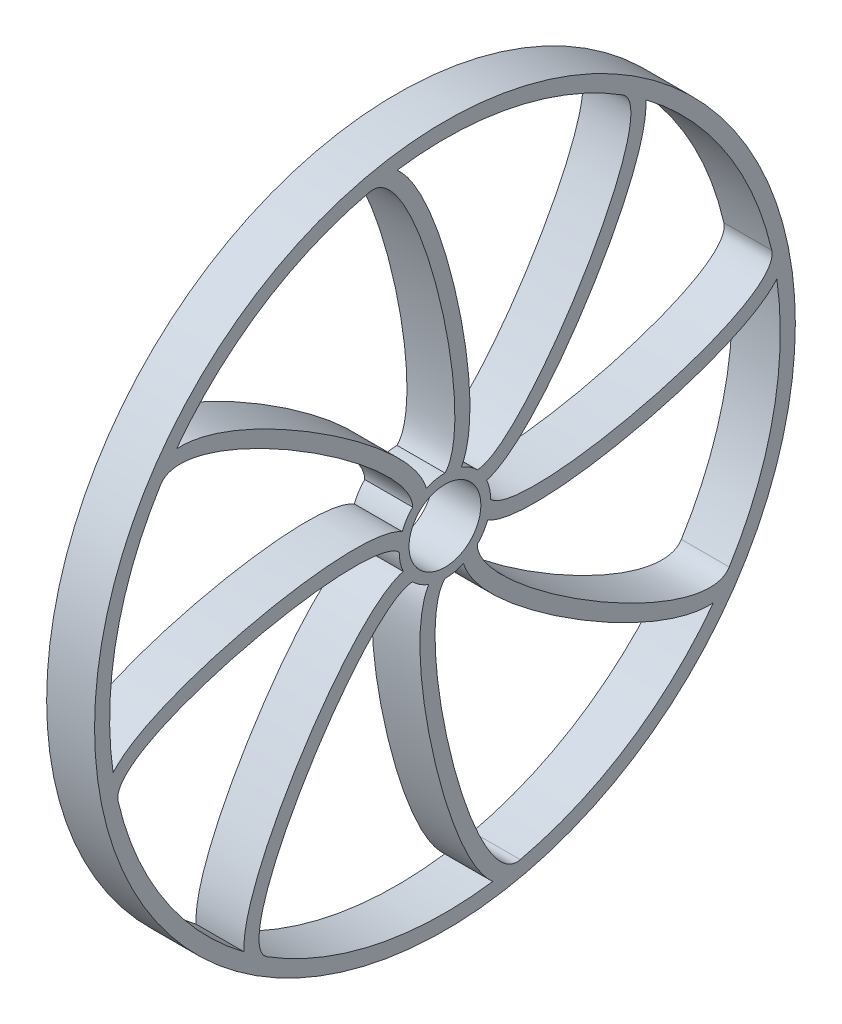
from build123d import *

# Parameters (mm, degrees)
SKETCH1_R             = 6.0625
SKETCH1_R_2           = 4.7625
BOSS_EXTRUDE1_DEPTH   = 3.175
SKETCH1_R_3           = 46.45
SKETCH1_R_4           = 44.45
BOSS_EXTRUDE1_2_DEPTH = 3.175
EXTRUDE_THIN2_START   = -3.175
EXTRUDE_THIN2_DEPTH   = 6.35
CIRPATTERN1_COUNT     = 8


# Read off the part's stored shape, not the designer's step: Extrude-Thin2
with BuildPart() as part:
    # Sketch1 → Boss-Extrude1 (new, symmetric)
    with BuildSketch(Plane(origin=(0, 0, 0), x_dir=(0, 0, -1), z_dir=(1, 0, 0))):
        Circle(SKETCH1_R)
        Circle(SKETCH1_R_2, mode=Mode.SUBTRACT)
    extrude(amount=BOSS_EXTRUDE1_DEPTH, both=True)



with BuildPart() as body_2:
    # Sketch1 → Boss-Extrude1 2 (new, symmetric)
    with BuildSketch(Plane(origin=(0, 0, 0), x_dir=(0, 0, -1), z_dir=(1, 0, 0))):
        Circle(SKETCH1_R_3)
        Circle(SKETCH1_R_4, mode=Mode.SUBTRACT)
    extrude(amount=BOSS_EXTRUDE1_2_DEPTH, both=True)


with BuildPart() as part_1:
    add(part.part)

    add(body_2.part)  # Extrude-Thin2 merges body 2
    # Extrude-Thin2 outline → Extrude-Thin2 (add)
    with BuildSketch(Plane(origin=(0, 0, 0), x_dir=(0, 0, -1), z_dir=(1, 0, 0)).offset(EXTRUDE_THIN2_START)):
        with BuildLine():
            add(Edge.make_bspline(
                [(-6.3355985, 43.996166784), (-6.255095923, 43.925032839), (-6.175963075, 43.852068198), (-5.548698351, 43.251204224), (-5.055604829, 42.640291134), (-4.116147204, 41.27108179), (-3.6714525, 40.51169877), (-2.385479272, 38.035518018), (-1.591781782, 36.118997617), (-0.134960901, 31.957605755), (0.525933851, 29.714211022), (1.670203871, 25.136721013), (2.153284246, 22.803242272), (2.890531028, 18.2847466), (3.145030649, 16.100931227), (3.311299949, 13.10122741), (3.330807031, 12.147155076), (3.286885537, 10.350080052), (3.224038366, 9.507507634), (2.992965499, 7.938587571), (2.827561189, 7.21225965), (2.459079192, 6.233276095), (2.328164202, 5.942334081), (2.170097204, 5.660793617)],
                knots=[0.116131233, 0.116131233, 0.116131233, 0.116131233, 0.125, 0.125, 0.1875, 0.1875, 0.25, 0.25, 0.375, 0.375, 0.5, 0.5, 0.625, 0.625, 0.75, 0.75, 0.8125, 0.8125, 0.875, 0.875, 0.9375, 0.9375, 0.965067589, 0.965067589, 0.965067589, 0.965067589], degree=3))
            ThreePointArc((-6.3355985, 43.996166784), (-8.165765838, 43.693509453), (-9.981711445, 43.31475426))
            add(Edge.make_bspline(
                [(-9.981711445, 43.31475426), (-3.408827872, 44.829448925), (4.490128061, 10.552628061), (0, 6.0625)],
                knots=[0, 0, 0, 0, 1, 1, 1, 1], degree=3))
            ThreePointArc((0, 6.0625), (1.103481977, 5.961227539), (2.170097204, 5.660793617))
        make_face()
    extrude_thin2 = extrude(amount=EXTRUDE_THIN2_DEPTH)

    # CirPattern1: Extrude-Thin2 ×8 about axis
    cirpattern1_axis = Axis((56.075510447, 0, 0), (-1, 0, 0))
    for i in range(1, CIRPATTERN1_COUNT):
        add(extrude_thin2.rotate(cirpattern1_axis, i * 360 / CIRPATTERN1_COUNT))


solid = part_1.part
